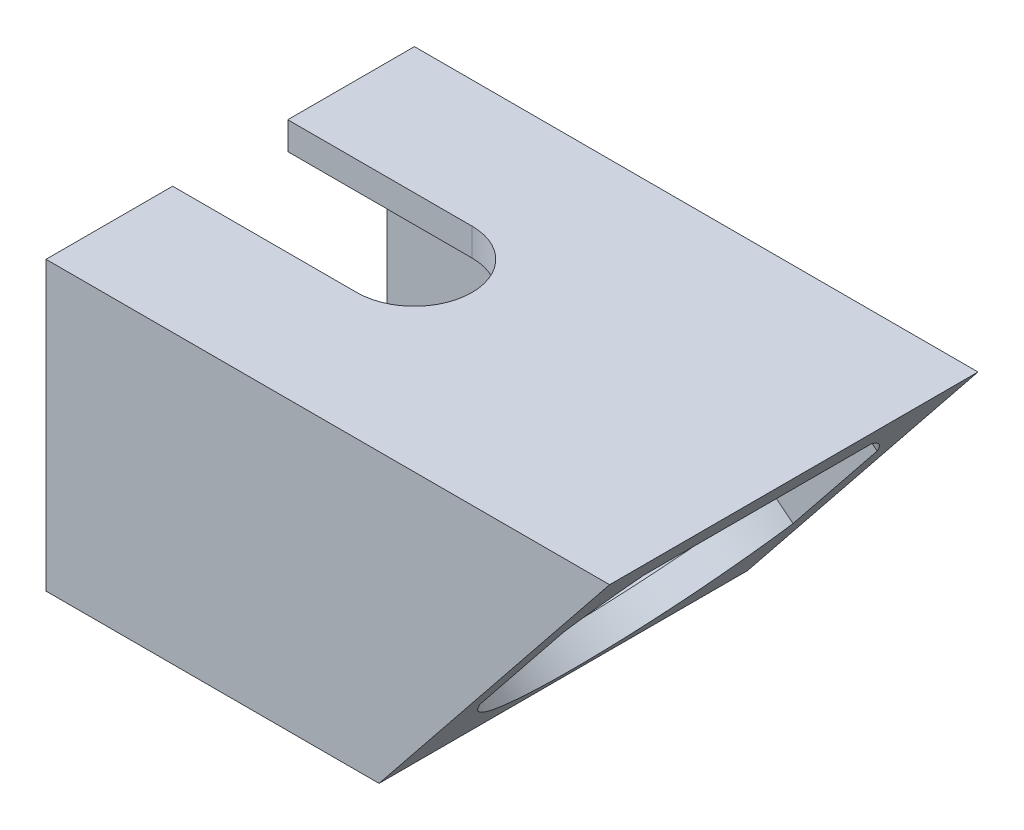
from build123d import *

# Parameters (mm, degrees)
BOSS_EXTRUDE1_DEPTH      = 20
BOSS_EXTRUDE1_DEPTH_BACK = 20
CUT_EXTRUDE1_REACH       = 75.759
SKETCH3_W                = 34
SKETCH3_H                = 25.2
CUT_EXTRUDE2_DEPTH       = 3
CUT_EXTRUDE3_REACH       = 57.409


with BuildPart() as part:
    # Sketch1 → Boss-Extrude1 (new, two sides: drawn at the far end of the back side and taken through both)
    with BuildSketch(Plane.XY.offset(-BOSS_EXTRUDE1_DEPTH_BACK)):
        Polygon((-20, -4.8), (41.191180555, -4.8), (16.16, -36), (-20, -36), align=None)
    extrude(amount=BOSS_EXTRUDE1_DEPTH + BOSS_EXTRUDE1_DEPTH_BACK)

    # Cut-Extrude1: up to this plane
    cut_extrude1_end = Plane(origin=(38.851180555, -2.922661458, -20), z_dir=(0.7799999999999999, -0.6257795138864808, 0))
    # Sketch3 → Cut-Extrude1 (cut, up to the surface)
    with BuildSketch(Plane.ZY.offset(20), mode=Mode.PRIVATE) as cut_extrude1_sk1:
        with Locations((0, -20.4)):
            Rectangle(SKETCH3_W, SKETCH3_H)
    cut_extrude1_tool1 = split(extrude(cut_extrude1_sk1.sketch, amount=-CUT_EXTRUDE1_REACH, mode=Mode.PRIVATE), bisect_by=cut_extrude1_end, keep=Keep.BOTH, mode=Mode.PRIVATE)
    add(cut_extrude1_tool1.solids().sort_by_distance((-20, -20.4, 0))[0], mode=Mode.SUBTRACT)

    # Sketch4 → Cut-Extrude2 (cut)
    with BuildSketch(Plane(origin=(25.06363275, -20.108087075, 0), x_dir=(0, 0, 1), z_dir=(-0.78, 0.6257795138864807, 0))):
        with BuildLine():
            Line((-17, 9.329856704), (-17, -5.264662815))
            ThreePointArc((-17, -5.264662815), (0, -16.467403056), (17, -5.264662815))
            Line((17, -5.264662815), (17, 9.329856704))
            ThreePointArc((17, 9.329856704), (15.039919545, 12.805285563), (12.38022373, 15.779598814))
            Line((12.38022373, 15.779598814), (-12.38022373, 15.779598814))
            ThreePointArc((-12.38022373, 15.779598814), (-15.039919545, 12.805285563), (-17, 9.329856704))
        make_face()
    extrude(amount=-CUT_EXTRUDE2_DEPTH, mode=Mode.SUBTRACT)

    # Sketch5 → Cut-Extrude3 (cut, up to next)
    with BuildSketch(Plane(origin=(0, -4.8, 0), x_dir=(1, 0, 0), z_dir=(0, 1, 0)), mode=Mode.PRIVATE) as cut_extrude3_sk1:
        with BuildLine():
            Line((0, 6.25), (-20, 6.25))
            Line((-20, 6.25), (-20, -6.25))
            Line((-20, -6.25), (0, -6.25))
            ThreePointArc((0, -6.25), (6.25, 0), (0, 6.25))
        make_face()
    cut_extrude3_tool1 = extrude(cut_extrude3_sk1.sketch, amount=-CUT_EXTRUDE3_REACH, mode=Mode.PRIVATE) & part.part
    add(cut_extrude3_tool1.solids().sort_by_distance((-7.506569, -4.8, 0))[0], mode=Mode.SUBTRACT)


solid = part.part
